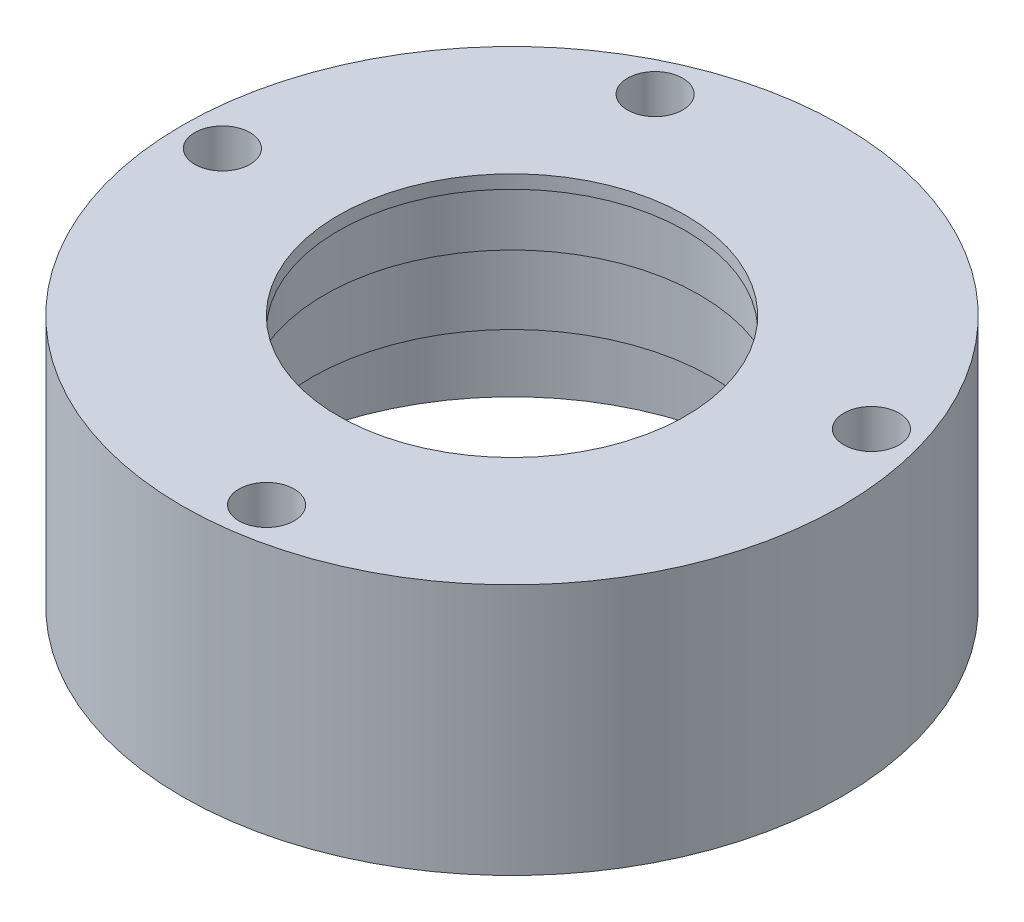
from build123d import *

# Parameters (mm, degrees)
SKETCH1_R           = 37
BOSS_EXTRUDE1_DEPTH = 28.25
SKETCH2_R           = 28.8
CUT_EXTRUDE1_DEPTH  = 11
SKETCH3_R           = 22.5
CUT_EXTRUDE2_DEPTH  = 8.75
SKETCH4_R           = 21.05
CUT_EXTRUDE3_DEPTH  = 7
SKETCH5_R           = 19.5
CUT_EXTRUDE4_DEPTH  = 59.767018812
SKETCH6_R           = 1.675
CUT_EXTRUDE5_DEPTH  = 15.75
CIRPATTERN1_COUNT   = 11
SKETCH7_R           = 1.7
CUT_EXTRUDE6_DEPTH  = 60.464800513
SKETCH8_R           = 3.1
CUT_EXTRUDE7_DEPTH  = 16.25


with BuildPart() as part:
    # Sketch1 → Boss-Extrude1 (new body)
    with BuildSketch(Plane(origin=(0, 0, 0), x_dir=(1, 0, 0), z_dir=(0, 1, 0))):
        Circle(SKETCH1_R)
    extrude(amount=BOSS_EXTRUDE1_DEPTH)

    # Sketch2 → Cut-Extrude1 (cut)
    with BuildSketch(Plane(origin=(0, 0, 0), x_dir=(1, 0, 0), z_dir=(0, 1, 0))):
        Circle(SKETCH2_R)
    extrude(amount=CUT_EXTRUDE1_DEPTH, mode=Mode.SUBTRACT)

    # Sketch3 → Cut-Extrude2 (cut)
    with BuildSketch(Plane.XZ.offset(-11)):
        Circle(SKETCH3_R)
    extrude(amount=-CUT_EXTRUDE2_DEPTH, mode=Mode.SUBTRACT)

    # Sketch4 → Cut-Extrude3 (cut)
    with BuildSketch(Plane.XZ.offset(-19.75)):
        Circle(SKETCH4_R)
    extrude(amount=-CUT_EXTRUDE3_DEPTH, mode=Mode.SUBTRACT)

    # Sketch5 → Cut-Extrude4 (cut, through all)
    with BuildSketch(Plane.XZ.offset(-26.75)):
        Circle(SKETCH5_R)
    extrude(amount=-CUT_EXTRUDE4_DEPTH, mode=Mode.SUBTRACT)

    # Sketch6 → Cut-Extrude5 (cut)
    with BuildSketch(Plane(origin=(0, 0, 0), x_dir=(1, 0, 0), z_dir=(0, 1, 0))):
        with Locations((27, 0)):
            Circle(SKETCH6_R)
    cut_extrude5 = extrude(amount=CUT_EXTRUDE5_DEPTH, mode=Mode.SUBTRACT)

    # CirPattern1: Cut-Extrude5 ×11 about axis
    cirpattern1_axis = Axis((0, 28.25, 0), (0, -1, 0))
    for i in range(1, CIRPATTERN1_COUNT):
        add(cut_extrude5.rotate(cirpattern1_axis, i * 360 / CIRPATTERN1_COUNT), mode=Mode.SUBTRACT)

    # Sketch7 → Cut-Extrude6 (cut, through all)
    with BuildSketch(Plane(origin=(0, 0, 0), x_dir=(1, 0, 0), z_dir=(0, 1, 0))):
        with Locations((31.184102699, 9.154328969)):
            Circle(SKETCH7_R)
        with Locations((-13.503333209, 29.56196868)):
            Circle(SKETCH7_R)
        with Locations((-32.5, 0)):
            Circle(SKETCH7_R)
        with Locations((4.624211408, -32.169343619)):
            Circle(SKETCH7_R)
    extrude(amount=CUT_EXTRUDE6_DEPTH, mode=Mode.SUBTRACT)

    # Sketch8 → Cut-Extrude7 (cut)
    with BuildSketch(Plane(origin=(0, 28.25, 0), x_dir=(1, 0, 0), z_dir=(0, 1, 0))):
        with Locations((31.184102699, 9.154328969)):
            Circle(SKETCH8_R)
        with Locations((-13.503333209, 29.56196868)):
            Circle(SKETCH8_R)
        with Locations((-32.5, 0)):
            Circle(SKETCH8_R)
        with Locations((4.624211408, -32.169343619)):
            Circle(SKETCH8_R)
    extrude(amount=-CUT_EXTRUDE7_DEPTH, mode=Mode.SUBTRACT)


solid = part.part
